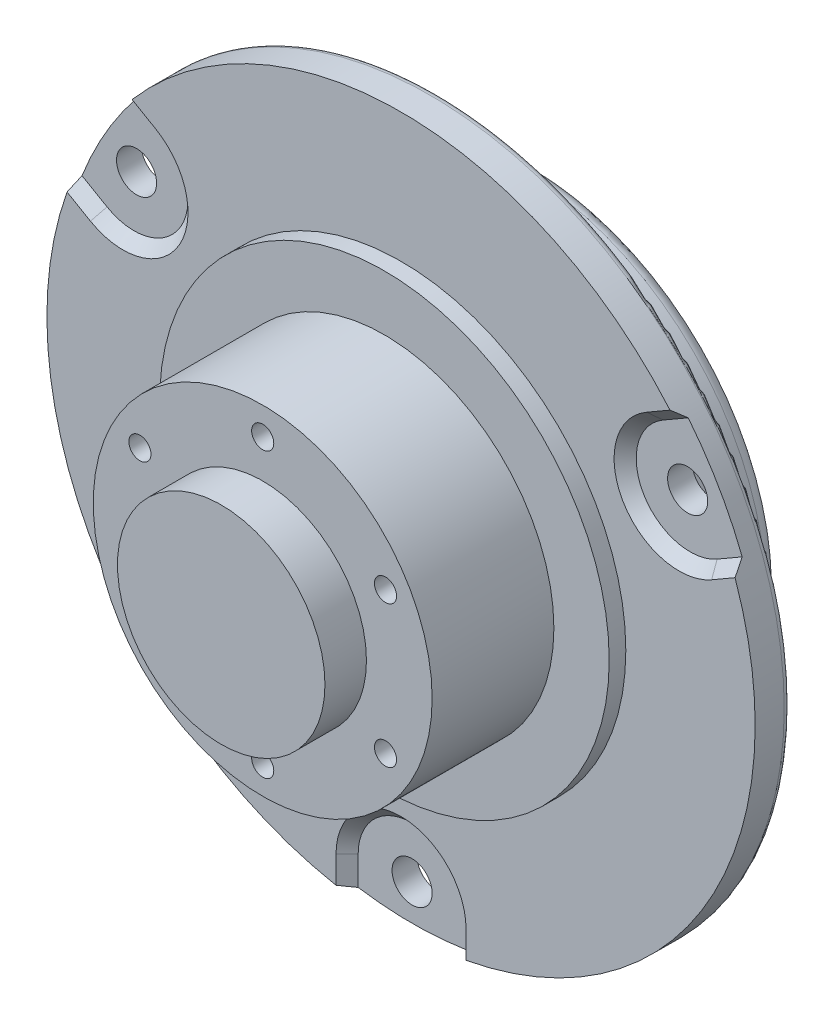
from build123d import *

# Parameters (mm, degrees)
SKETCH4_R                    = 25.6
BOSS_EXTRUDE5_DEPTH          = 2.6
SKETCH5_R                    = 16.25
BOSS_EXTRUDE6_DEPTH          = 1.2
SKETCH6_R                    = 12.25
BOSS_EXTRUDE7_DEPTH          = 8.8
SKETCH7_R                    = 7.5
BOSS_EXTRUDE8_DEPTH          = 3
FILLET2_R                    = 0.5
CUT_EXTRUDE1_DEPTH           = 0.8
CHAMFER2_SIZE                = 0.8
M2_5_CLEARANCE_HOLE1_D       = 2.9
CIRPATTERN1_COUNT            = 3
CHAMFER2_OF_CIRPATTERN1_SIZE = 0.8
CIRPATTERN2_COUNT            = 6
SKETCH13_R                   = 18.75
BOSS_EXTRUDE9_DEPTH          = 2
SKETCH14_R                   = 17.75
BOSS_EXTRUDE10_DEPTH         = 5
CUT_EXTRUDE3_START           = -1.8
CUT_EXTRUDE3_DEPTH           = 1.8
FILLET6_R                    = 2
FILLET8_R                    = 1


# Some blends are built 0.0001 mm under size
with BuildPart() as part:
    # Sketch4 → Boss-Extrude5 (new body)
    with BuildSketch(Plane.XY):
        Circle(SKETCH4_R)
    extrude(amount=BOSS_EXTRUDE5_DEPTH)

    # Sketch5 → Boss-Extrude6 (add)
    with BuildSketch(Plane.XY.offset(2.6)):
        Circle(SKETCH5_R)
    extrude(amount=BOSS_EXTRUDE6_DEPTH)

    # Sketch6 → Boss-Extrude7 (add)
    with BuildSketch(Plane.XY.offset(3.8)):
        Circle(SKETCH6_R)
    extrude(amount=BOSS_EXTRUDE7_DEPTH)

    # Sketch7 → Boss-Extrude8 (add)
    with BuildSketch(Plane.XY.offset(12.6)):
        Circle(SKETCH7_R)
    extrude(amount=BOSS_EXTRUDE8_DEPTH)

    # Fillet2
    fillet2_edges = [part.edges().sort_by_distance(p)[0] for p in [
        (-25.6, 0, 0),
    ]]
    fillet(fillet2_edges, radius=FILLET2_R)

    # Sketch8 → Cut-Extrude1 (cut)
    with BuildSketch(Plane.XY.offset(2.6)):
        with BuildLine():
            Line((3.9, -23.210366581), (3.9, -30.789633419))
            ThreePointArc((3.9, -30.789633419), (0, -34.689633419), (-3.9, -30.789633419))
            Line((-3.9, -30.789633419), (-3.9, -23.210366581))
            ThreePointArc((-3.9, -23.210366581), (0, -19.310366581), (3.9, -23.210366581))
        make_face()
    cut_extrude1 = extrude(amount=-CUT_EXTRUDE1_DEPTH, mode=Mode.SUBTRACT)

    # Chamfer2
    chamfer2_edges = [part.edges().sort_by_distance(p)[0] for p in [
        (-3.9, -24.255776162, 2.6),
        (0, -19.310366581, 2.6),
        (3.9, -24.255776162, 2.6),
    ]]
    chamfer(chamfer2_edges, length=CHAMFER2_SIZE - 0.0001)  # a hair under: the kernel refuses the full size

    # M2.5 Clearance Hole1 (through all)
    with Locations(Plane.XY.offset(1.8)):
        with Locations((0, -23)):
            m2_5_clearance_hole1 = Hole(M2_5_CLEARANCE_HOLE1_D / 2)

    # CirPattern1: Cut-Extrude1, M2.5 Clearance Hole1 ×3 about axis
    cirpattern1_axis = Axis((0, 0, 0), (0, 0, 1))
    add([cut_extrude1.rotate(cirpattern1_axis, i * 360 / CIRPATTERN1_COUNT) for i in range(1, CIRPATTERN1_COUNT)], mode=Mode.SUBTRACT)
    add([m2_5_clearance_hole1.rotate(cirpattern1_axis, i * 360 / CIRPATTERN1_COUNT) for i in range(1, CIRPATTERN1_COUNT)], mode=Mode.SUBTRACT)

    # Chamfer2 of CirPattern1
    chamfer2_of_cirpattern1_edges = [part.edges().sort_by_distance(p)[0] for p in [
        (22.956118345, 8.750389006, 2.6),
        (16.723268015, 9.65518329, 2.6),
        (19.056118345, 15.505387156, 2.6),
        (-19.056118345, 15.505387156, 2.6),
        (-16.723268015, 9.65518329, 2.6),
        (-22.956118345, 8.750389006, 2.6),
    ]]
    chamfer(chamfer2_of_cirpattern1_edges, length=CHAMFER2_OF_CIRPATTERN1_SIZE - 0.0001)  # a hair under: the kernel refuses the full size

    # Sketch12 → Tap Drill for M2x0.4 Tap1 (revolve, cut)
    with BuildSketch(Plane(origin=(0, -10.25, 12.6), x_dir=(0, -1, 0), z_dir=(1, 0, 0))):
        Polygon((0, 0), (0, 6.480688495), (0.8, 6), (0.8, 0), align=None)
    tap_drill_for_m2x0_4_tap1 = revolve(axis=Axis((0, -10.25, 18.95), (0, 0, -1)), mode=Mode.SUBTRACT)

    # CirPattern2: Tap Drill for M2x0.4 Tap1 ×6 about axis
    cirpattern2_axis = Axis((0, 0, 0), (0, 0, 1))
    for i in range(1, CIRPATTERN2_COUNT):
        add(tap_drill_for_m2x0_4_tap1.rotate(cirpattern2_axis, i * 360 / CIRPATTERN2_COUNT), mode=Mode.SUBTRACT)

    # Sketch13 → Boss-Extrude9 (add)
    with BuildSketch(Plane(origin=(0, 0, 0), x_dir=(-1, 0, 0), z_dir=(0, 0, -1))):
        with Locations(Location((0, 0, 0), (0, 0, 180))):
            Circle(SKETCH13_R)
    extrude(amount=BOSS_EXTRUDE9_DEPTH)

    # Sketch14 → Boss-Extrude10 (add)
    with BuildSketch(Plane(origin=(0, 0, -2), x_dir=(-1, 0, 0), z_dir=(0, 0, -1))):
        Circle(SKETCH14_R)
    extrude(amount=BOSS_EXTRUDE10_DEPTH)

    # Sketch17 → Cut-Extrude3 (cut)
    with BuildSketch(Plane(origin=(0, 0, -7), x_dir=(-1, 0, 0), z_dir=(0, 0, -1)).offset(CUT_EXTRUDE3_START)):
        with BuildLine():
            Line((-0.28156747, -7.28156747), (-2.121320344, -9.121320344))
            ThreePointArc((-2.121320344, -9.121320344), (-2.707106781, -10.535533906), (-2.121320344, -11.949747468))
            Line((-2.121320344, -11.949747468), (3.358335088, -17.4294029))
            ThreePointArc((3.358335088, -17.4294029), (12.551145366, -12.551145366), (17.4294029, -3.358335088))
            Line((17.4294029, -3.358335088), (11.949747468, 2.121320344))
            ThreePointArc((11.949747468, 2.121320344), (10.535533906, 2.707106781), (9.121320344, 2.121320344))
            Line((9.121320344, 2.121320344), (7.28156747, 0.28156747))
            ThreePointArc((7.28156747, 0.28156747), (7.075303297, -0.018410953), (6.99008997, -0.372346897))
            ThreePointArc((6.99008997, -0.372346897), (4.949747468, -4.949747468), (0.372346897, -6.99008997))
            ThreePointArc((0.372346897, -6.99008997), (0.018410953, -7.075303297), (-0.28156747, -7.28156747))
        make_face()
    extrude(amount=CUT_EXTRUDE3_DEPTH, mode=Mode.SUBTRACT)

    # Fillet6
    # the kernel refuses this fillet: 2 mm, written as the material it takes off along each edge
    with BuildSketch(Plane(origin=(-17.4294029, -3.358335088, -5.2), x_dir=(-0.05717413002562378, 0.9983642215423252, 0), z_dir=(0, 0, -1))) as fillet6_piece_1:
        with BuildLine():
            CenterArc((4.447159251, 1.982298833), FILLET6_R, 138.277623698, 139.350968751)
            Line((2.954402599, 3.313342625), (0, 0))
            ThreePointArc((0, 0), (2.356330648, -0.157097855), (4.712661296, 0))
        make_face()
    extrude(amount=13.58165324, mode=Mode.SUBTRACT)
    with BuildSketch(Plane(origin=(-3.358335088, -17.4294029, -5.2), x_dir=(0.9983642215423252, -0.057174130025623736, 0), z_dir=(0, 0, -1))) as fillet6_piece_2:
        with BuildLine():
            CenterArc((4.447159251, -1.982298833), FILLET6_R, 82.371407551, 139.350968751)
            Line((2.954402599, -3.313342625), (0, 0))
            ThreePointArc((0, 0), (2.356330648, 0.157097855), (4.712661296, 0))
        make_face()
    extrude(amount=13.58165324, mode=Mode.SUBTRACT)

    # Fillet8
    fillet8_edges = [part.edges().sort_by_distance(p)[0] for p in [
        (-10.535533906, 2.707106781, -7),
        (-8.201443907, 1.201443907, -7),
        (-7.075303297, -0.018410953, -7),
        (-4.949747468, -4.949747468, -7),
        (-0.018410953, -7.075303297, -7),
        (1.201443907, -8.201443907, -7),
        (2.707106781, -10.535533906, -7),
        (0.950996294, -13.120071518, -7),
        (-13.120071518, 0.950996294, -7),
        (12.551145366, 12.551145366, -7),
        (-0.622487974, -16.539565739, -7),
        (-16.539565739, -0.622487974, -7),
    ]]
    fillet(fillet8_edges, radius=FILLET8_R)


solid = part.part
